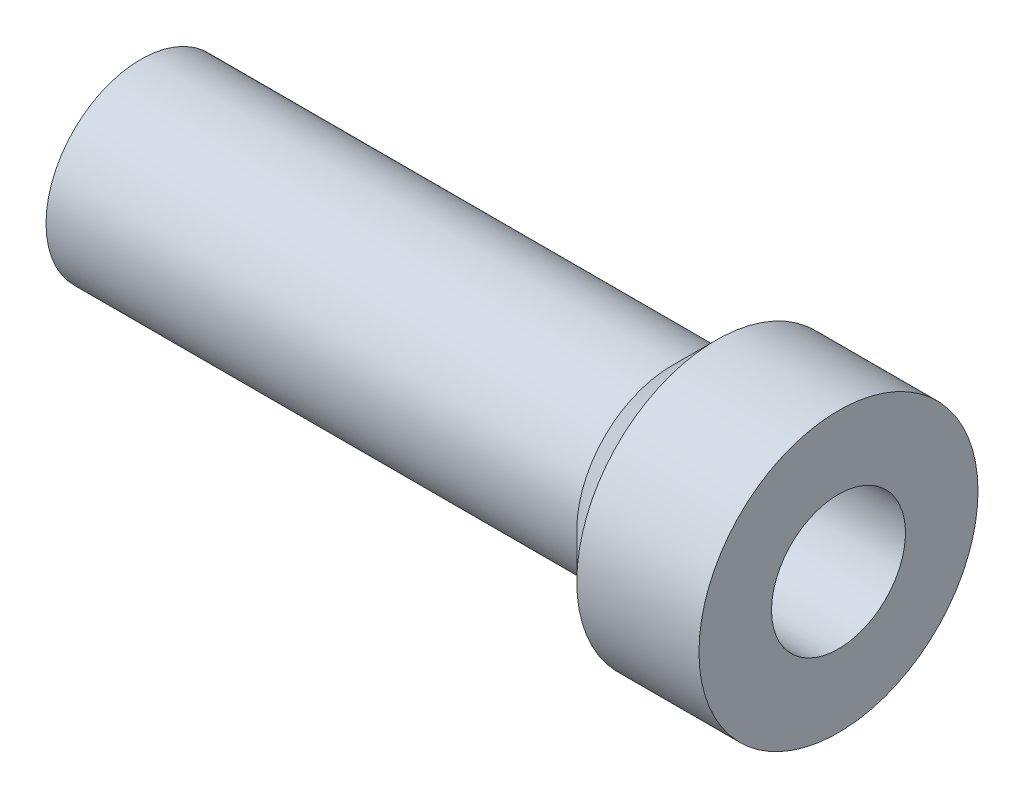
from build123d import *


with BuildPart() as part:
    # Sketch2 → Revolve1 (revolve)
    with BuildSketch(Plane.XY):
        Polygon((0, 8.5), (0, 6), (45, 6), (45, 4.25), (47.5, 4.25), (47.5, 6), (62.5, 6), (62.5, 12.5), (51.552970295, 12.5), (47.552970295, 8.5), align=None)
    revolve(axis=Axis((0, 0, 0), (1, 0, 0)))


solid = part.part
